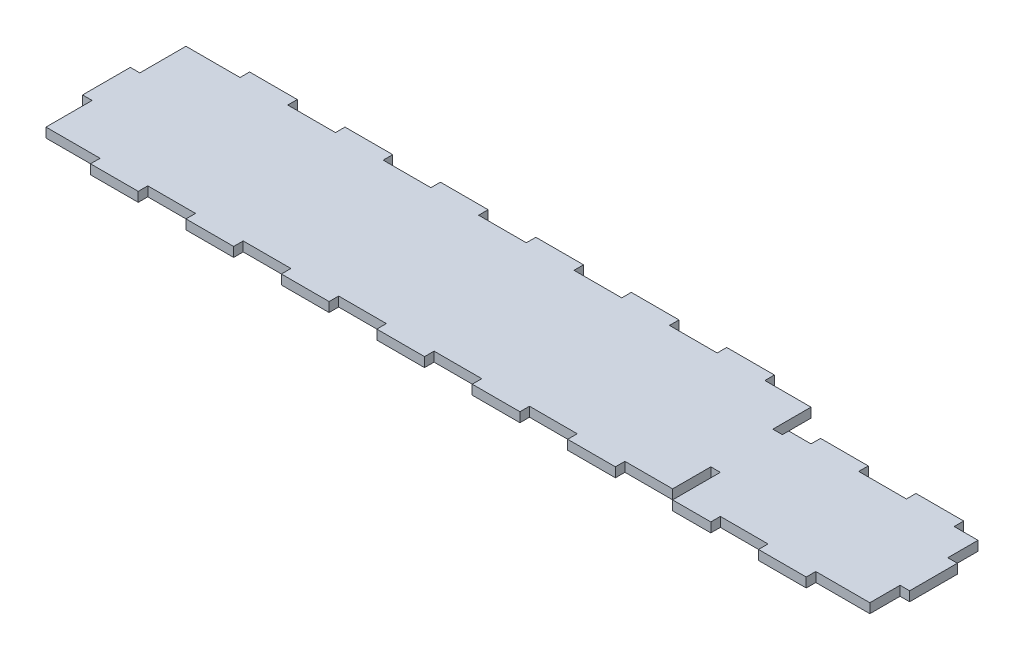
from build123d import *

# Parameters (mm, degrees)
SALIENTE_EXTRUIR1_DEPTH = 3


with BuildPart() as part:
    # Croquis1 → Saliente-Extruir1 (new body)
    with BuildSketch(Plane(origin=(0, 0, 0), x_dir=(1, 0, 0), z_dir=(0, 1, 0))):
        Polygon((35, 50), (20, 50), (20, 47), (3, 47), (3, 32.5), (0, 32.5), (0, 25), (0, 17.5), (3, 17.5), (3, 3), (20, 3), (20, 0), (35, 0), (35, 3), (50, 3), (50, 0), (65, 0), (65, 3), (80, 3), (80, 0), (95, 0), (95, 3), (110, 3), (110, 0), (125, 0), (125, 3), (140, 3), (140, 0), (155, 0), (155, 3), (170, 3), (170, 0), (185, 0), (185, 3), (197, 3), (200, 3), (200, 15), (203, 15), (203, 0), (215, 0), (215, 3), (230, 3), (230, 0), (245, 0), (245, 3), (262, 3), (262, 12.5), (265, 12.5), (265, 20), (265, 27.5), (262, 27.5), (262, 37), (254.5, 37), (254.5, 40), (239.5, 40), (239.5, 37), (224.5, 37), (224.5, 40), (209.5, 40), (209.5, 37), (202.5, 37), (202.5, 35), (199.5, 35), (199.5, 37), (199.5, 47), (196.5, 47), (185, 47), (185, 50), (170, 50), (170, 47), (155, 47), (155, 50), (140, 50), (140, 47), (125, 47), (125, 50), (110, 50), (110, 47), (95, 47), (95, 50), (80, 50), (80, 47), (65, 47), (65, 50), (50, 50), (50, 47), (35, 47), align=None)
    extrude(amount=SALIENTE_EXTRUIR1_DEPTH)


solid = part.part
